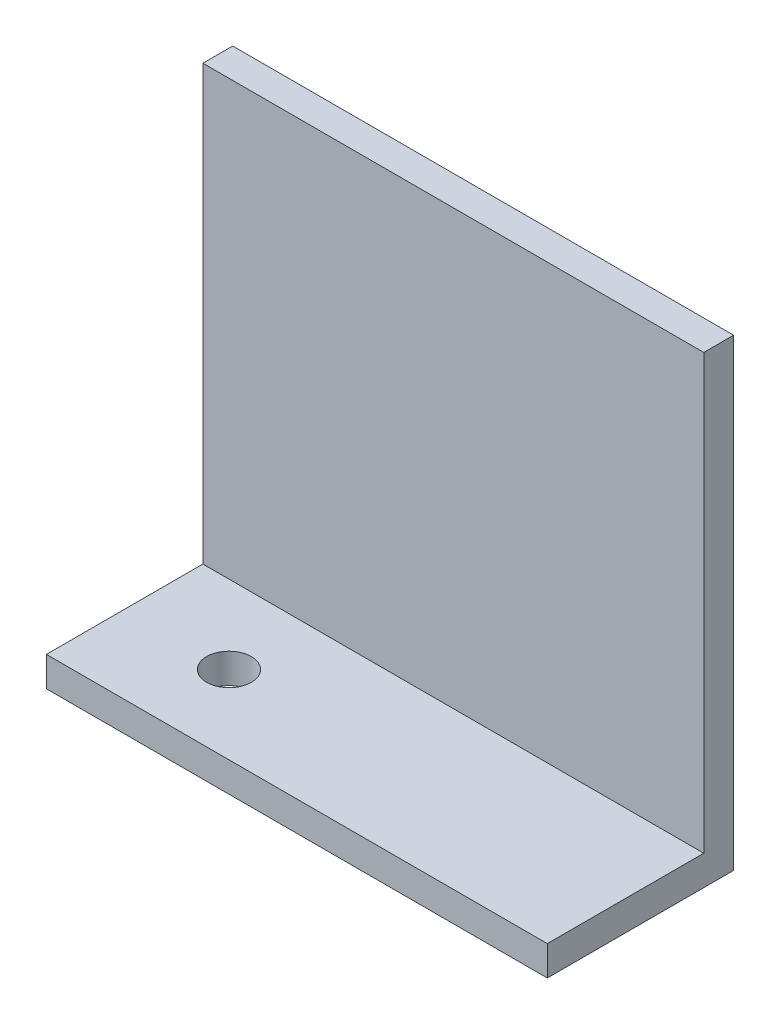
from build123d import *

# Parameters (mm, degrees)
SKETCH1_W           = 33.609338415
SKETCH1_H           = 12.5
BOSS_EXTRUDE1_DEPTH = 2
SKETCH2_W           = 33.609338415
SKETCH2_H           = 29.102375501
BOSS_EXTRUDE2_DEPTH = 2
SKETCH3_R           = 1.5
CUT_EXTRUDE1_DEPTH  = 2


with BuildPart() as part:
    # Sketch1 → Boss-Extrude1 (new body)
    with BuildSketch(Plane(origin=(0, 0, 0), x_dir=(1, 0, 0), z_dir=(0, 1, 0))):
        with Locations((16.804669208, 6.25)):
            Rectangle(SKETCH1_W, SKETCH1_H)
    extrude(amount=BOSS_EXTRUDE1_DEPTH)

    # Sketch2 → Boss-Extrude2 (add)
    with BuildSketch(Plane(origin=(0, 0, -12.5), x_dir=(-1, 0, 0), z_dir=(0, 0, -1))):
        with Locations((-16.804669208, 16.55118775)):
            Rectangle(SKETCH2_W, SKETCH2_H)
    extrude(amount=-BOSS_EXTRUDE2_DEPTH)

    # Sketch3 → Cut-Extrude1 (cut)
    with BuildSketch(Plane(origin=(0, 2, 0), x_dir=(1, 0, 0), z_dir=(0, 1, 0))):
        with Locations((7, 5.25)):
            Circle(SKETCH3_R)
    extrude(amount=-CUT_EXTRUDE1_DEPTH, mode=Mode.SUBTRACT)


solid = part.part
